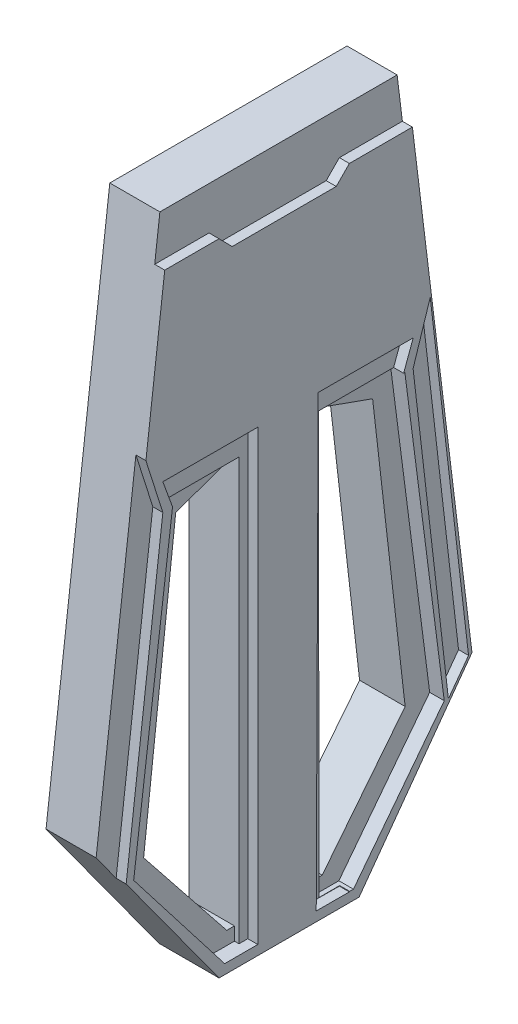
from build123d import *

# Parameters (mm, degrees)
BOSS_EXTRUDE1_DEPTH = 13.2
CUT_EXTRUDE1_DEPTH  = 2.2
CUT_EXTRUDE5_DEPTH  = 3.2
CUT_EXTRUDE7_DEPTH  = 47.2


with BuildPart() as part:
    # Sketch1 → Boss-Extrude1 (new body)
    with BuildSketch(Plane(origin=(0, 0, 0), x_dir=(0, 0, -1), z_dir=(1, 0, 0))):
        Polygon((0.00037, 0), (30.749847102, 0), (55.543477102, 34.125504075), (41.306638332, 150), (-10.793062749, 150), (-24.79363, 34.126013336), align=None)
    extrude(amount=BOSS_EXTRUDE1_DEPTH)

    # Sketch2 → Cut-Extrude1 (cut)
    with BuildSketch(Plane(origin=(13.2, 0, 0), x_dir=(0, 0, -1), z_dir=(1, 0, 0))):
        Polygon((-12.344468939, 94.703766721), (-16.059096103, 106.416317448), (-24.79363, 34.126013336), (-20.395280759, 28.072204962), align=None)
        Polygon((-10.793062749, 150), (-11.929169586, 140.597150379), (0, 140.597150379), (2.885234275, 137.672830794), (25.738927324, 137.672830794), (28.624161599, 140.604667527), (42.460989275, 140.604667527), (41.306638332, 150), align=None)
        Polygon((8.515657019, 100.504390557), (-12.344468939, 100.550644482), (-10.21067195, 94.703766721), (-18.748622589, 27.94782175), (1.233460106, 2.115562465), (8.515657019, 2.115562465), align=None)
        Polygon((42.612553576, 94.581908493), (50.367798457, 27.915299382), (54.792950981, 33.949543082), (46.379085297, 106.277870971), align=None)
        Polygon((28.624161599, 2.054828055), (48.720604882, 27.79821975), (40.478777569, 94.59137114), (42.638482443, 100.428728761), (21.778356485, 100.474982686), (21.342036292, 2.087122062), align=None)
    extrude(amount=-CUT_EXTRUDE1_DEPTH, mode=Mode.SUBTRACT)

    # Sketch5 → Cut-Extrude5 (cut)
    with BuildSketch(Plane(origin=(13.2, 0, 0), x_dir=(0, 0, -1), z_dir=(1, 0, 0))):
        Polygon((6.582413404, 94.703766721), (-10.21067195, 94.703766721), (-18.748622589, 27.94782175), (1.233460106, 2.115562465), (6.582413404, 2.115562465), align=None)
        Polygon((49.454706487, 28.001620882), (40.811451684, 94.744013231), (24.018387228, 94.717520306), (24.164455225, 2.129431268), (29.513401868, 2.137869826), align=None)
    extrude(amount=-CUT_EXTRUDE5_DEPTH, mode=Mode.SUBTRACT)

    # Sketch8 → Cut-Extrude7 (cut)
    with BuildSketch(Plane(origin=(10, 0, 0), x_dir=(0, 0, -1), z_dir=(1, 0, 0))):
        Polygon((6.582413404, 94.703766721), (-6.314173101, 90.065077615), (-13.364980543, 27.947791436), (4.888229968, 5.020235463), (6.582413404, 5.020235463), align=None)
        Polygon((25.854054115, 5.036773412), (24.159872787, 5.034100652), (24.018387228, 94.717520306), (36.922275722, 90.099182744), (44.071071189, 27.993097285), align=None)
    extrude(amount=-CUT_EXTRUDE7_DEPTH, mode=Mode.SUBTRACT)


solid = part.part
